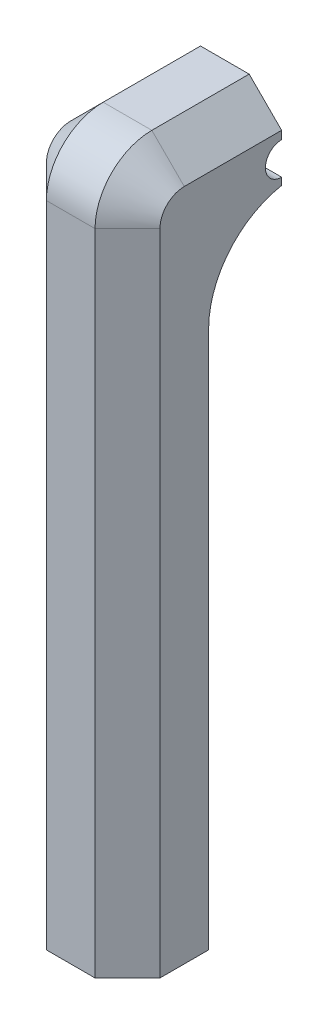
from build123d import *

# Parameters (mm, degrees)
Y_KSEKLIK_EKSTR_ZYON4_DEPTH = 35
RADYUS1_R                   = 17.5
RADYUS2_R                   = 17.5
IZIM4_R                     = 5
KES_EKSTR_ZYON1_DEPTH       = 223.331396793
PAH1_SIZE                   = 10
PAH2_SIZE                   = 10
PAH4_SIZE                   = 10
PAH5_SIZE                   = 10


with BuildPart() as part:
    # Çizim3 → Yükseklik-Ekstrüzyon4 (new body)
    with BuildSketch(Plane(origin=(0, 0, 0), x_dir=(0, 0, -1), z_dir=(1, 0, 0))):
        Polygon((17.5, 182.5), (17.5, 0), (-17.5, 0), (-17.5, 217.5), (30, 217.5), (30, 182.5), align=None)
    extrude(amount=Y_KSEKLIK_EKSTR_ZYON4_DEPTH)

    # Radyus1
    radyus1_edges = [part.edges().sort_by_distance(p)[0] for p in [
        (17.5, 217.5, 17.5),
    ]]
    fillet(radyus1_edges, radius=RADYUS1_R)

    # Radyus2
    # the kernel refuses this fillet: 17.5 mm, written as the material it adds along each edge
    with BuildSketch(Plane(origin=(0, 182.5, -17.5), x_dir=(0, -1, 0), z_dir=(1, 0, 0))) as radyus2_piece_1:
        with BuildLine():
            CenterArc((16.770509831, 17.5), RADYUS2_R, 196.601549599, 73.398450401)
            Line((0, 12.5), (-0.335410197, 12.4))
            ThreePointArc((-0.335410197, 12.4), (-0.35, 6.25), (-0.35, 0))
            Line((-0.35, 0), (0, -0.35))
            Line((0, -0.35), (16.770509831, -0.35))
            Line((16.770509831, -0.35), (16.770509831, 0))
        make_face()
    extrude(amount=35)

    # Çizim4 → Kes-Ekstrüzyon1 (cut, through all)
    with BuildSketch(Plane(origin=(35, 0, 0), x_dir=(0, 0, -1), z_dir=(1, 0, 0))):
        with Locations((30, 200)):
            Circle(IZIM4_R)
    extrude(amount=-KES_EKSTR_ZYON1_DEPTH, mode=Mode.SUBTRACT)

    # Pah1
    pah1_edges = [part.edges().sort_by_distance(p)[0] for p in [
        (0, 100, 17.5),
        (0, 212.374368671, 12.374368671),
        (0, 217.5, -15),
    ]]
    chamfer(pah1_edges, length=PAH1_SIZE)

    # Pah2
    pah2_edges = [part.edges().sort_by_distance(p)[0] for p in [
        (35, 217.5, -15),
        (35, 100, 17.5),
        (35, 212.374368671, 12.374368671),
    ]]
    chamfer(pah2_edges, length=PAH2_SIZE)

    # Pah4
    pah4_edges = [part.edges().sort_by_distance(p)[0] for p in [
        (35, 82.864745084, -17.5),
        (35, 176.1877405, -20.9687848),
    ]]
    chamfer(pah4_edges, length=PAH4_SIZE)

    # Pah5
    pah5_edges = [part.edges().sort_by_distance(p)[0] for p in [
        (0, 176.1877405, -20.9687848),
        (0, 82.864745084, -17.5),
    ]]
    chamfer(pah5_edges, length=PAH5_SIZE)


solid = part.part
